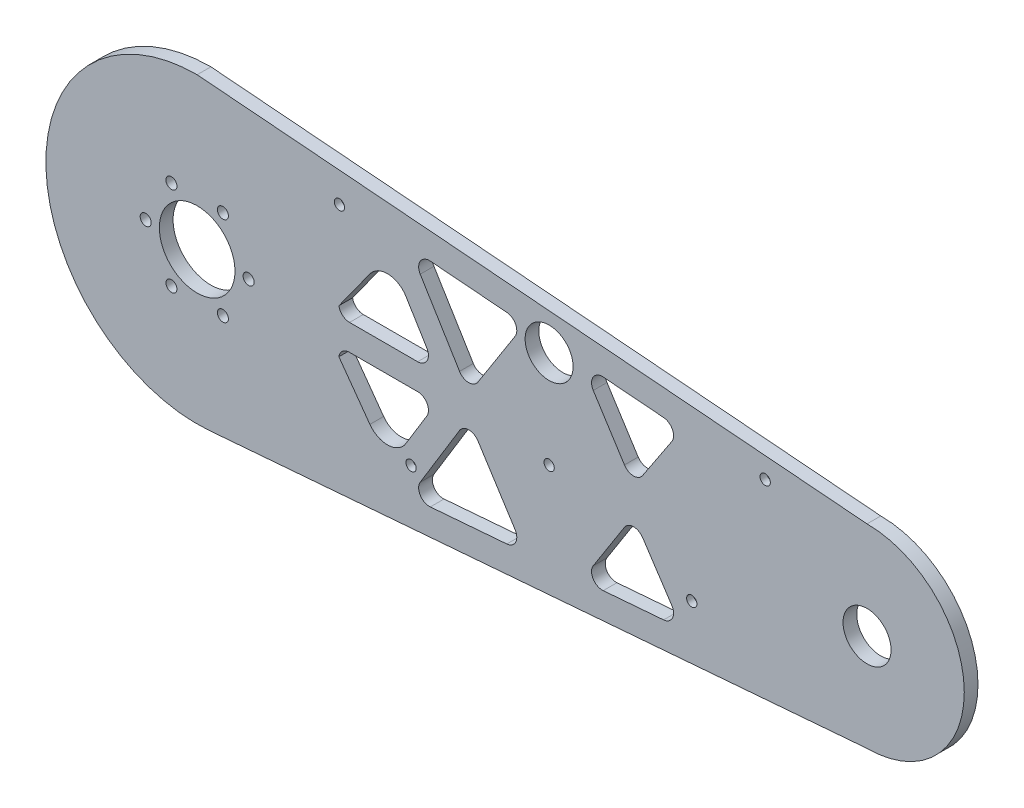
from build123d import *

# Parameters (mm, degrees)
SKETCH1_R              = 14.29385
SKETCH1_R_2            = 11.115
SKETCH1_R_3            = 11.1125
BOSS_EXTRUDE1_DEPTH    = 6.35
CROQUIS1_R             = 2.38125
CORTAR_EXTRUIR1_DEPTH  = 50
CROQUIS6_R             = 2.38125
CORTAR_EXTRUIR6_DEPTH  = 10
CROQUIS8_R             = 17.5
CORTAR_EXTRUIR8_DEPTH  = 10
CROQUIS9_R             = 2.5527
CORTAR_EXTRUIR9_DEPTH  = 10
CROQUIS5_R             = 2.38125
CORTAR_EXTRUIR5_DEPTH  = 10
CROQUIS10_R            = 5
CORTAR_EXTRUIR10_DEPTH = 3.18


with BuildPart() as part:
    # Sketch1 → Boss-Extrude1 (new body)
    with BuildSketch(Plane.XY):
        with BuildLine():
            Line((0, 70), (310, 45))
            ThreePointArc((310, 45), (355, 0), (310, -45))
            Line((310, -45), (5.171398252, -69.808714643))
            ThreePointArc((5.171398252, -69.808714643), (-69.952162315, -2.587467389), (0, 70))
        make_face()
        Circle(SKETCH1_R, mode=Mode.SUBTRACT)
        with Locations((310, 0)):
            Circle(SKETCH1_R_2, mode=Mode.SUBTRACT)
        with Locations((162.878542763, 40)):
            Circle(SKETCH1_R_3, mode=Mode.SUBTRACT)
        with BuildLine():
            Line((107.898974887, 49.259511156), (143.314248041, 46.40344074))
            ThreePointArc((143.314248041, 46.40344074), (147.389908855, 43.644764005), (147.127454118, 38.730252238))
            Line((147.127454118, 38.730252238), (129.916226305, 11.754586611))
            ThreePointArc((129.916226305, 11.754586611), (125.651076231, 9.444205574), (121.433006579, 11.839462159))
            Line((121.433006579, 11.839462159), (103.228961238, 41.671198203))
            ThreePointArc((103.228961238, 41.671198203), (103.238833139, 46.896293531), (107.898974887, 49.259511156))
        make_face(mode=Mode.SUBTRACT)
        with BuildLine():
            Line((70.523244027, 6), (102.03004784, 6))
            ThreePointArc((102.03004784, 6), (106.3902351, 8.552804247), (106.298140539, 13.604493178))
            Line((106.298140539, 13.604493178), (96.590354482, 29.513051181))
            ThreePointArc((96.590354482, 29.513051181), (88.437172177, 34.296727565), (79.941746192, 30.151166228))
            Line((79.941746192, 30.151166228), (65.58297828, 10.229432452))
            ThreePointArc((65.58297828, 10.229432452), (67.271539685, 7.201787411), (70.523244027, 6))
        make_face(mode=Mode.SUBTRACT)
        with BuildLine():
            Line((219.623774494, 32.810522613), (206.130928429, 12.417497436))
            ThreePointArc((206.130928429, 12.417497436), (201.919524559, 10.176643248), (197.745901529, 12.48710226))
            Line((197.745901529, 12.48710226), (183.296864227, 35.133505128))
            ThreePointArc((183.296864227, 35.133505128), (183.227765467, 40.400743015), (187.913912204, 42.80669363))
            Line((187.913912204, 42.80669363), (215.855795571, 40.553315939))
            ThreePointArc((215.855795571, 40.553315939), (219.949772588, 37.757395035), (219.623774494, 32.810522613))
        make_face(mode=Mode.SUBTRACT)
        with BuildLine():
            Line((96.590354482, -29.513051181), (106.298140539, -13.604493178))
            ThreePointArc((106.298140539, -13.604493178), (106.3902351, -8.552804247), (102.03004784, -6))
            Line((102.03004784, -6), (70.523244027, -6))
            ThreePointArc((70.523244027, -6), (67.271539685, -7.201787411), (65.58297828, -10.229432452))
            Line((65.58297828, -10.229432452), (79.941746192, -30.151166228))
            ThreePointArc((79.941746192, -30.151166228), (88.437172177, -34.296727565), (96.590354482, -29.513051181))
        make_face(mode=Mode.SUBTRACT)
        with BuildLine():
            Line((187.913912204, -42.80669363), (215.855795571, -40.553315939))
            ThreePointArc((215.855795571, -40.553315939), (219.949772588, -37.757395035), (219.623774494, -32.810522613))
            Line((219.623774494, -32.810522613), (206.130928429, -12.417497436))
            ThreePointArc((206.130928429, -12.417497436), (201.919524559, -10.176643248), (197.745901529, -12.48710226))
            Line((197.745901529, -12.48710226), (183.296864227, -35.133505128))
            ThreePointArc((183.296864227, -35.133505128), (183.227765467, -40.400743015), (187.913912204, -42.80669363))
        make_face(mode=Mode.SUBTRACT)
        with BuildLine():
            Line((121.433006579, -11.839462159), (103.228961238, -41.671198203))
            ThreePointArc((103.228961238, -41.671198203), (103.238833139, -46.896293531), (107.898974887, -49.259511156))
            Line((107.898974887, -49.259511156), (143.314248041, -46.40344074))
            ThreePointArc((143.314248041, -46.40344074), (147.389908855, -43.644764005), (147.127454118, -38.730252238))
            Line((147.127454118, -38.730252238), (129.916226305, -11.754586611))
            ThreePointArc((129.916226305, -11.754586611), (125.651076231, -9.444205574), (121.433006579, -11.839462159))
        make_face(mode=Mode.SUBTRACT)
    extrude(amount=BOSS_EXTRUDE1_DEPTH)

    # Croquis1 → Cortar-Extruir1 (cut)
    with BuildSketch(Plane.XY.offset(6.35)):
        with Locations((98.995555235, -37.090103176)):
            Circle(CROQUIS1_R)
        with Locations((228.877351461, -26.519571404)):
            Circle(CROQUIS1_R)
    extrude(amount=-CORTAR_EXTRUIR1_DEPTH, mode=Mode.SUBTRACT)

    # Croquis6 → Cortar-Extruir6 (cut)
    with BuildSketch(Plane.XY.offset(6.35)):
        with Locations((65.84135797, 50.868973694)):
            Circle(CROQUIS6_R)
        with Locations((262.871569637, 39.210126075)):
            Circle(CROQUIS6_R)
    extrude(amount=-CORTAR_EXTRUIR6_DEPTH, mode=Mode.SUBTRACT)

    # Croquis8 → Cortar-Extruir8 (cut)
    with BuildSketch(Plane.XY.offset(6.35)):
        Circle(CROQUIS8_R)
    extrude(amount=-CORTAR_EXTRUIR8_DEPTH, mode=Mode.SUBTRACT)

    # Croquis9 → Cortar-Extruir9 (cut)
    with BuildSketch(Plane(origin=(0, 0, 0), x_dir=(-1, 0, 0), z_dir=(0, 0, -1))):
        with Locations((23.8125, 0)):
            Circle(CROQUIS9_R)
        with Locations((11.90625, -20.622229928)):
            Circle(CROQUIS9_R)
        with Locations((-11.90625, -20.622229928)):
            Circle(CROQUIS9_R)
        with Locations((-23.8125, 0)):
            Circle(CROQUIS9_R)
        with Locations((-11.90625, 20.622229928)):
            Circle(CROQUIS9_R)
        with Locations((11.90625, 20.622229928)):
            Circle(CROQUIS9_R)
    extrude(amount=-CORTAR_EXTRUIR9_DEPTH, mode=Mode.SUBTRACT)

    # Croquis5 → Cortar-Extruir5 (cut)
    with BuildSketch(Plane.XY.offset(6.35)):
        with Locations((162.878542763, -5)):
            Circle(CROQUIS5_R)
    extrude(amount=-CORTAR_EXTRUIR5_DEPTH, mode=Mode.SUBTRACT)

    # Croquis10 → Cortar-Extruir10 (cut)
    with BuildSketch(Plane(origin=(0, 0, 0), x_dir=(-1, 0, 0), z_dir=(0, 0, -1))):
        with Locations((-262.871569637, 39.210126075)):
            Circle(CROQUIS10_R)
        with Locations((-65.84135797, 50.868973694)):
            Circle(CROQUIS10_R)
        with Locations((-162.878542763, 0)):
            Circle(CROQUIS10_R)
        with Locations((-228.877351461, -26.519571404)):
            Circle(CROQUIS10_R)
        with Locations((-98.995555235, -37.090103176)):
            Circle(CROQUIS10_R)
    extrude(amount=-CORTAR_EXTRUIR10_DEPTH, mode=Mode.SUBTRACT)


solid = part.part
